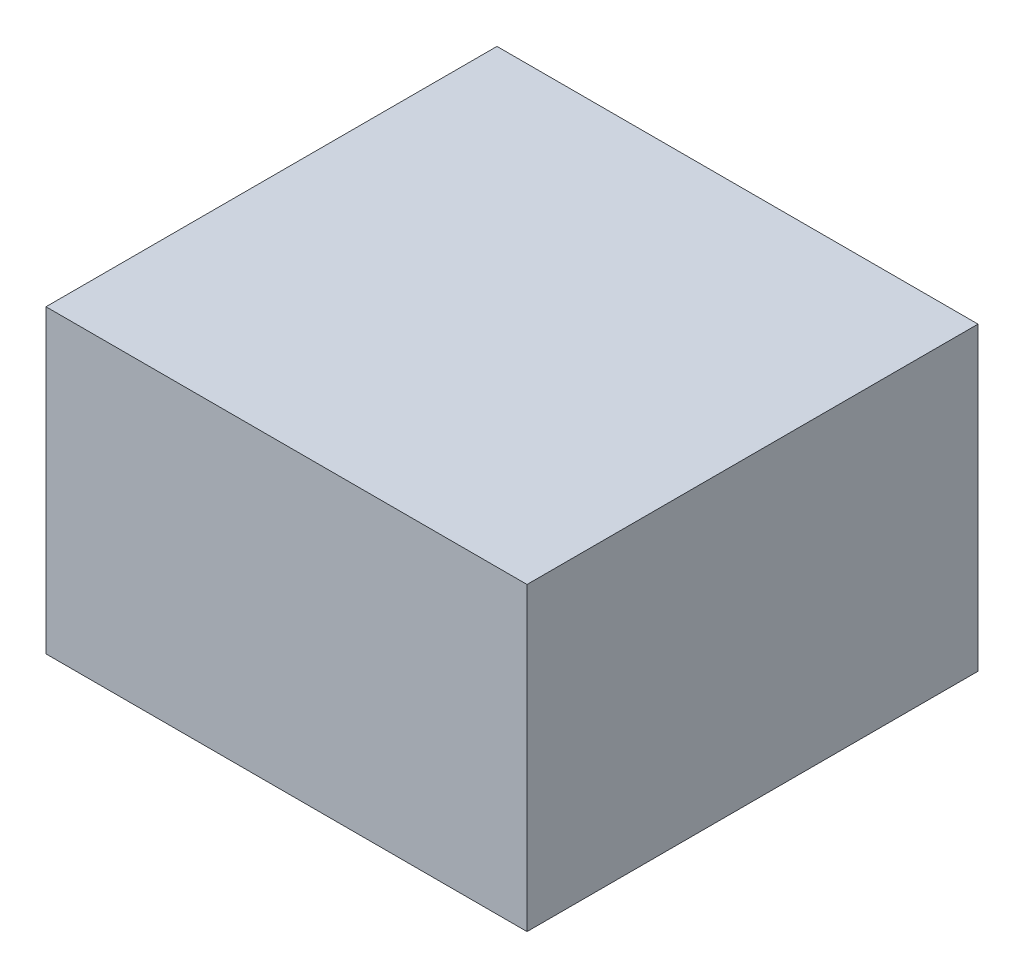
from build123d import *

# Parameters (mm, degrees)
SKETCH1_W           = 16
SKETCH1_H           = 15
BOSS_EXTRUDE1_DEPTH = 10


with BuildPart() as part:
    # Sketch1 → Boss-Extrude1 (new body)
    with BuildSketch(Plane(origin=(0, 0, 0), x_dir=(1, 0, 0), z_dir=(0, 1, 0))):
        with Locations((8, -7.5)):
            Rectangle(SKETCH1_W, SKETCH1_H)
    extrude(amount=BOSS_EXTRUDE1_DEPTH)


solid = part.part
